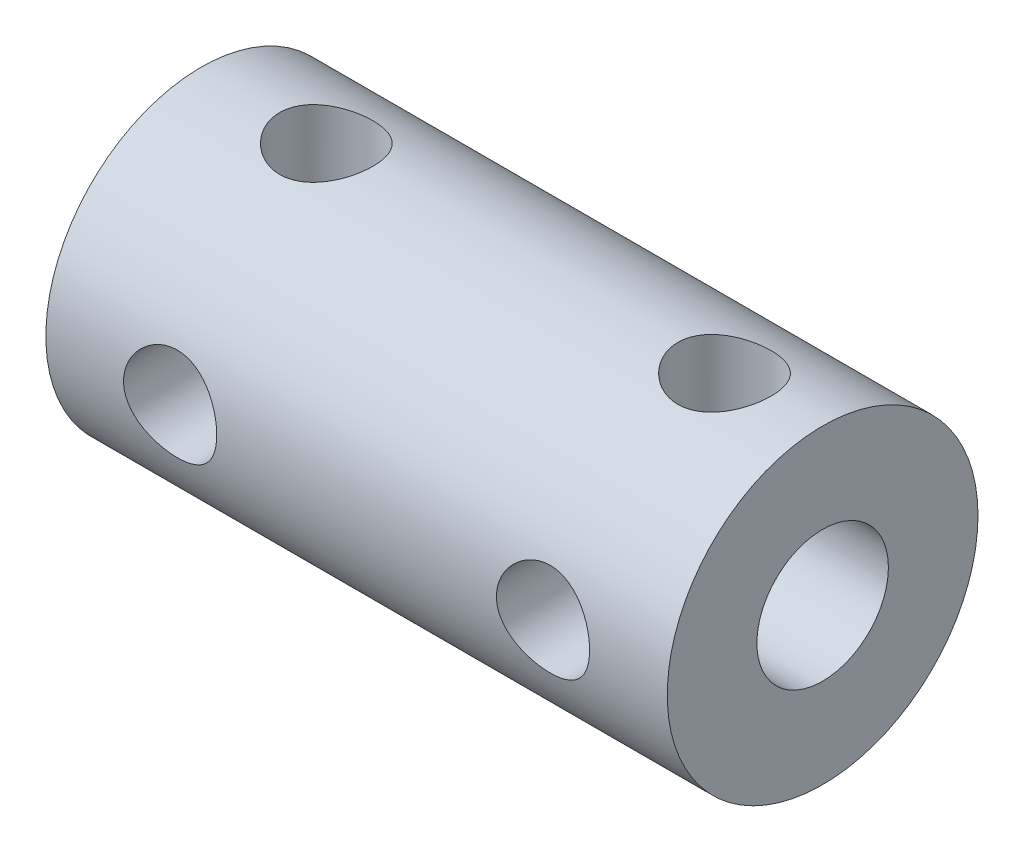
from build123d import *

# Parameters (mm, degrees)
CROQUIS1_R                                 = 7.5
CROQUIS1_R_2                               = 3.877864762
SALIENTE_EXTRUIR1_DEPTH                    = 15
CROQUIS3_R                                 = 7.5
CROQUIS3_R_2                               = 3.175
SALIENTE_EXTRUIR2_DEPTH                    = 15
TALADRO_DE_MARGEN_PARA_M41_D               = 4.5
TALADRO_DE_MARGEN_PARA_M41_DEPTH           = 7.5
TALADRO_DE_MARGEN_PARA_M41_TIP             = 1.351936393
TALADRO_DE_MARGEN_PARA_M41_ON_FACE_2_D     = 4.5
TALADRO_DE_MARGEN_PARA_M41_ON_FACE_2_DEPTH = 7.5
TALADRO_DE_MARGEN_PARA_M41_ON_FACE_2_TIP   = 1.351936393
TALADRO_DE_MARGEN_PARA_M41_ON_FACE_3_D     = 4.5
TALADRO_DE_MARGEN_PARA_M41_ON_FACE_3_DEPTH = 7.5
TALADRO_DE_MARGEN_PARA_M41_ON_FACE_3_TIP   = 1.351936393


with BuildPart() as part:
    # Croquis1 → Saliente-Extruir1 (new body)
    with BuildSketch(Plane(origin=(0, 0, 0), x_dir=(0, 0, -1), z_dir=(1, 0, 0))):
        Circle(CROQUIS1_R)
        Circle(CROQUIS1_R_2, mode=Mode.SUBTRACT)
    extrude(amount=SALIENTE_EXTRUIR1_DEPTH)

    # Croquis3 → Saliente-Extruir2 (add)
    with BuildSketch(Plane(origin=(15, 0, 0), x_dir=(0, 0, -1), z_dir=(1, 0, 0))):
        Circle(CROQUIS3_R)
        Circle(CROQUIS3_R_2, mode=Mode.SUBTRACT)
    extrude(amount=SALIENTE_EXTRUIR2_DEPTH)

    # Taladro de margen para M41
    with Locations(Plane(origin=(6.041751124, 7.5, 0), x_dir=(0, 0, 1), z_dir=(0, 1, 0))):
        with Locations((0, 0), (0, 19.220388763)):
            Hole(TALADRO_DE_MARGEN_PARA_M41_D / 2, depth=TALADRO_DE_MARGEN_PARA_M41_DEPTH)
            with Locations((0, 0, -(TALADRO_DE_MARGEN_PARA_M41_DEPTH + TALADRO_DE_MARGEN_PARA_M41_TIP / 2))):  # 118° drill point
                Cone(0, TALADRO_DE_MARGEN_PARA_M41_D / 2, TALADRO_DE_MARGEN_PARA_M41_TIP, mode=Mode.SUBTRACT)

    # Taladro de margen para M41 on face 2
    with Locations(Plane(origin=(6, 0, 7.5), x_dir=(1, 0, 0), z_dir=(0, 0, 1))):
        with Locations((0, 0), (18, 0)):
            Hole(TALADRO_DE_MARGEN_PARA_M41_ON_FACE_2_D / 2, depth=TALADRO_DE_MARGEN_PARA_M41_ON_FACE_2_DEPTH)
            with Locations((0, 0, -(TALADRO_DE_MARGEN_PARA_M41_ON_FACE_2_DEPTH + TALADRO_DE_MARGEN_PARA_M41_ON_FACE_2_TIP / 2))):  # 118° drill point
                Cone(0, TALADRO_DE_MARGEN_PARA_M41_ON_FACE_2_D / 2, TALADRO_DE_MARGEN_PARA_M41_ON_FACE_2_TIP, mode=Mode.SUBTRACT)

    # Taladro de margen para M41 on face 3
    with Locations(Plane(origin=(-116.474048572, 0, -29.182020138), x_dir=(0, 0, 1), z_dir=(0, 1, 0))):
        with Locations((0, 0)):
            Hole(TALADRO_DE_MARGEN_PARA_M41_ON_FACE_3_D / 2, depth=TALADRO_DE_MARGEN_PARA_M41_ON_FACE_3_DEPTH)
            with Locations((0, 0, -(TALADRO_DE_MARGEN_PARA_M41_ON_FACE_3_DEPTH + TALADRO_DE_MARGEN_PARA_M41_ON_FACE_3_TIP / 2))):  # 118° drill point
                Cone(0, TALADRO_DE_MARGEN_PARA_M41_ON_FACE_3_D / 2, TALADRO_DE_MARGEN_PARA_M41_ON_FACE_3_TIP, mode=Mode.SUBTRACT)


solid = part.part
